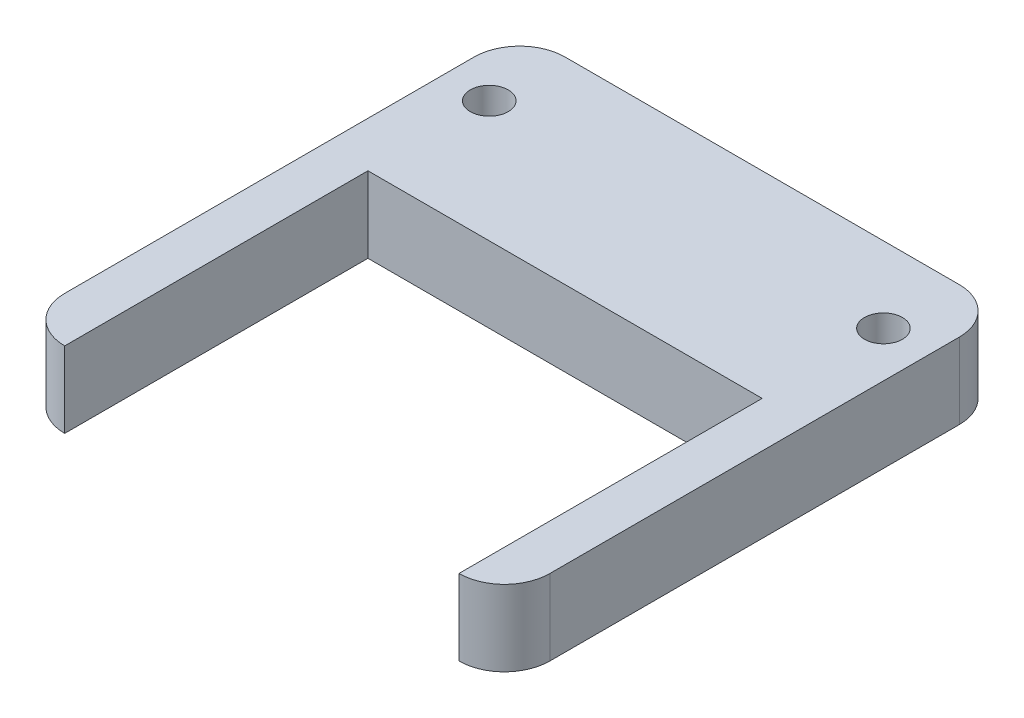
from build123d import *

# Parameters (mm, degrees)
SKETCH1_R           = 1.25
BOSS_EXTRUDE1_DEPTH = 5
FILLET1_R           = 3


with BuildPart() as part:
    # Sketch1 → Boss-Extrude1 (new body)
    with BuildSketch(Plane(origin=(0, 0, 0), x_dir=(1, 0, 0), z_dir=(0, 1, 0))):
        Polygon((29, 0), (32, 0), (32, 33), (0, 33), (0, 0), (3, 0), (3, 20), (29, 20), align=None)
        with Locations(Location((3, 28, 0), (0, 0, 270))):
            Circle(SKETCH1_R, mode=Mode.SUBTRACT)
        with Locations(Location((29, 28, 0), (0, 0, 270))):
            Circle(SKETCH1_R, mode=Mode.SUBTRACT)
    extrude(amount=BOSS_EXTRUDE1_DEPTH)

    # Fillet1
    fillet1_edges = [part.edges().sort_by_distance(p)[0] for p in [
        (0, 2.5, -33),
        (32, 2.5, -33),
        (32, 2.5, 0),
        (0, 2.5, 0),
    ]]
    fillet(fillet1_edges, radius=FILLET1_R - 0.0001)  # a hair under: the kernel refuses the full size


solid = part.part
